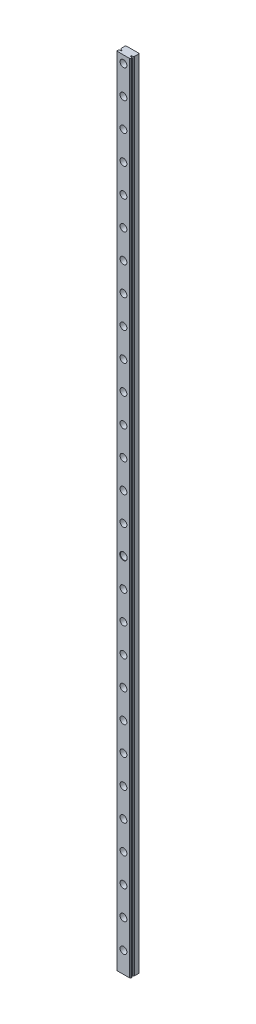
from build123d import *

# Parameters (mm, degrees)
DELKA_DEPTH         = 362.75
BOSS_EXTRUDE1_START = 337.25
BOSS_EXTRUDE1_DEPTH = 337.25
D_RA1_D             = 3.5
D_RA1_CBORE_D       = 6
D_RA1_CBORE_DEPTH   = 4.5
LPATTERN1_COUNT     = 13
LPATTERN1_PITCH     = 25
LPATTERN1_COL_COUNT = 16
LPATTERN1_COL_PITCH = 25


with BuildPart() as part:
    # Skica1 → Delka (new body)
    with BuildSketch(Plane(origin=(0, 0, 0), x_dir=(1, 0, 0), z_dir=(0, 1, 0))):
        with BuildLine():
            Line((-5.5, -8), (5.5, -8))
            Line((5.5, -8), (6, -7.5))
            Line((6, -7.5), (6, -6.661895004))
            ThreePointArc((6, -6.661895004), (5.52983318, -6.420240767), (5.209128789, -6))
            Line((5.209128789, -6), (4, -5.95))
            Line((4, -5.95), (4, -5.05))
            Line((4, -5.05), (5.209128789, -5))
            ThreePointArc((5.209128789, -5), (5.52983318, -4.579759233), (6, -4.338104996))
            Line((6, -4.338104996), (6, -0.5))
            Line((6, -0.5), (5.5, 0))
            Line((5.5, 0), (-1.6, 0))
            ThreePointArc((-1.6, 0), (-2, -0.2), (-2.4, 0))
            Line((-2.4, 0), (-5.5, 0))
            Line((-5.5, 0), (-6, -0.5))
            Line((-6, -0.5), (-6, -4.338104996))
            ThreePointArc((-6, -4.338104996), (-5.52983318, -4.579759233), (-5.209128789, -5))
            Line((-5.209128789, -5), (-4, -5.05))
            Line((-4, -5.05), (-4, -5.95))
            Line((-4, -5.95), (-5.209128789, -6))
            ThreePointArc((-5.209128789, -6), (-5.52983318, -6.420240767), (-6, -6.661895004))
            Line((-6, -6.661895004), (-6, -7.5))
            Line((-6, -7.5), (-5.5, -8))
        make_face()
    extrude(amount=DELKA_DEPTH)

    # Sketch1 → Boss-Extrude1 (add)
    with BuildSketch(Plane.XZ.offset(BOSS_EXTRUDE1_START)):
        with BuildLine():
            Line((6, 6.661895004), (6, 7.5))
            Line((6, 7.5), (5.5, 8))
            Line((5.5, 8), (-5.5, 8))
            Line((-5.5, 8), (-6, 7.5))
            Line((-6, 7.5), (-6, 6.661895004))
            ThreePointArc((-6, 6.661895004), (-5.52983318, 6.420240767), (-5.209128789, 6))
            Line((-5.209128789, 6), (-4, 5.95))
            Line((-4, 5.95), (-4, 5.05))
            Line((-4, 5.05), (-5.209128789, 5))
            ThreePointArc((-5.209128789, 5), (-5.52983318, 4.579759233), (-6, 4.338104996))
            Line((-6, 4.338104996), (-6, 0.5))
            Line((-6, 0.5), (-5.5, 0))
            Line((-5.5, 0), (-2.4, 0))
            ThreePointArc((-2.4, 0), (-2, 0.2), (-1.6, 0))
            Line((-1.6, 0), (5.5, 0))
            Line((5.5, 0), (6, 0.5))
            Line((6, 0.5), (6, 4.338104996))
            ThreePointArc((6, 4.338104996), (5.52983318, 4.579759233), (5.209128789, 5))
            Line((5.209128789, 5), (4, 5.05))
            Line((4, 5.05), (4, 5.95))
            Line((4, 5.95), (5.209128789, 6))
            ThreePointArc((5.209128789, 6), (5.52983318, 6.420240767), (6, 6.661895004))
        make_face()
    extrude(amount=-BOSS_EXTRUDE1_DEPTH)

    # Díra1 (through all)
    with Locations(Plane.XY.offset(8)):
        with Locations((0, -18.875)):
            d_ra1 = CounterBoreHole(D_RA1_D / 2, D_RA1_CBORE_D / 2, D_RA1_CBORE_DEPTH)

    # Zkosení1: read off the stored shape, not the designer's step
    # Zkosení1 outline → Zkosení1 (revolve, cut)
    with BuildSketch(Plane.XZ.offset(18.875)):
        Polygon((2.050001495, -1.495e-06), (1.75, 0.3), (1.75, -1.495e-06), align=None)
        Polygon((3, 8), (3, 7.7), (3.3, 8), align=None)
    revolve(axis=Axis((0, -18.875, 0), (0, 0, 1)), mode=Mode.SUBTRACT)

    # LPattern1: Díra1 ×13
    with Locations(*[(0, -i * LPATTERN1_PITCH, 0) for i in range(1, LPATTERN1_COUNT)]):
        add(d_ra1, mode=Mode.SUBTRACT)

    # LPattern1 col: Díra1 ×16
    with Locations(*[(0, i * LPATTERN1_COL_PITCH, 0) for i in range(1, LPATTERN1_COL_COUNT)]):
        add(d_ra1, mode=Mode.SUBTRACT)


solid = part.part
